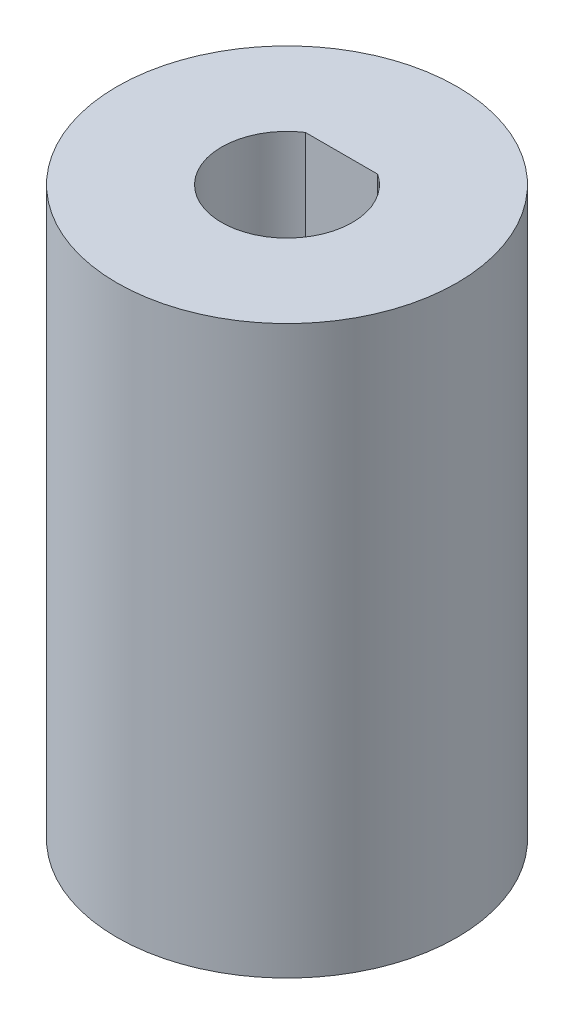
from build123d import *

# Parameters (mm, degrees)
SKETCH1_R           = 7.8
BOSS_EXTRUDE1_DEPTH = 26
CUT_EXTRUDE3_DEPTH  = 29.243229277


with BuildPart() as part:
    # Sketch1 → Boss-Extrude1 (new body)
    with BuildSketch(Plane(origin=(0, 0, 0), x_dir=(1, 0, 0), z_dir=(0, 1, 0))):
        Circle(SKETCH1_R)
    extrude(amount=BOSS_EXTRUDE1_DEPTH)

    # Sketch2 → Cut-Extrude3 (cut, through all)
    with BuildSketch(Plane(origin=(0, 0, 0), x_dir=(1, 0, 0), z_dir=(0, 1, 0))):
        with BuildLine():
            Line((1.658312395, 2.5), (-1.658312395, 2.5))
            ThreePointArc((-1.658312395, 2.5), (-1.418637165, -2.643382037), (3, 0))
            ThreePointArc((3, 0), (2.643382037, 1.418637165), (1.658312395, 2.5))
        make_face()
    extrude(amount=CUT_EXTRUDE3_DEPTH, mode=Mode.SUBTRACT)


solid = part.part
